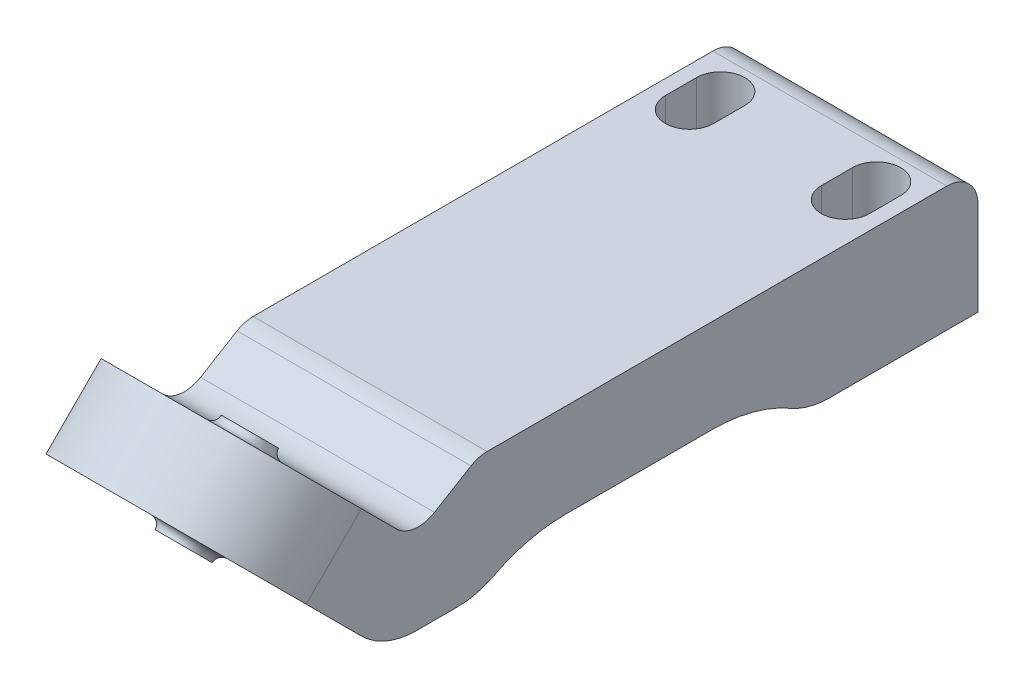
from build123d import *

# Parameters (mm, degrees)
SKETCH_10_W         = 15
SKETCH_10_H         = 8
EXTRUDE_7_DEPTH     = 26
CUT_EXTRUDE_4_DEPTH = 11
SKETCH_12_W         = 15
SKETCH_12_H         = 6
EXTRUDE_8_DEPTH     = 6
SKETCH_14_W         = 15
SKETCH_14_H         = 5
EXTRUDE_9_DEPTH     = 4
EXTRUDE_10_DEPTH    = 15
EXTRUDE_11_DEPTH    = 5
SKETCH_19_R         = 1.1
CUT_EXTRUDE_5_DEPTH = 5
EXTRUDE_START       = 0.5
SKETCH_20_R         = 1.5
SKETCH_20_R_2       = 1.1
EXTRUDE_12_DEPTH    = 0.5
SKETCH_21_R         = 1.5
SKETCH_21_R_2       = 1.1
EXTRUDE_13_DEPTH    = 0.5
FILLET_4_R          = 0.5
CHAMFER_1_SIZE      = 4.493554602
CHAMFER_1_SIZE_2    = 2.7
FILLET_7_R          = 2
SKETCH_22_W         = 15
SKETCH_22_H         = 2
CUT_EXTRUDE_6_DEPTH = 15
FILLET_8_R          = 10
FILLET_9_R          = 5
FILLET_10_R         = 2


# Some blends are built 0.0001 mm under size
with BuildPart() as part:
    # 草图10 → 凸台-拉伸7 (new body)
    with BuildSketch(Plane.XY):
        with Locations((0, 24.68211788)):
            Rectangle(SKETCH_10_W, SKETCH_10_H)
    extrude(amount=EXTRUDE_7_DEPTH)

    # 草图11 → 切除-拉伸4 (cut)
    with BuildSketch(Plane(origin=(0, 28.68211788, 0), x_dir=(1, 0, 0), z_dir=(0, 1, 0))):
        with BuildLine():
            Line((-3.45, -4), (-3.45, -6))
            ThreePointArc((-3.45, -6), (-5, -7.55), (-6.55, -6))
            Line((-6.55, -6), (-6.55, -4))
            ThreePointArc((-6.55, -4), (-5, -2.45), (-3.45, -4))
        make_face()
        with BuildLine():
            Line((3.45, -4), (3.45, -6))
            ThreePointArc((3.45, -6), (5, -7.55), (6.55, -6))
            Line((6.55, -6), (6.55, -4))
            ThreePointArc((6.55, -4), (5, -2.45), (3.45, -4))
        make_face()
    extrude(amount=-CUT_EXTRUDE_4_DEPTH, mode=Mode.SUBTRACT)

    # 草图12 → 凸台-拉伸8 (add)
    with BuildSketch(Plane.XY.offset(26)):
        with Locations((0, 25.68211788)):
            Rectangle(SKETCH_12_W, SKETCH_12_H)
    extrude(amount=EXTRUDE_8_DEPTH)

    # 草图14 → 凸台-拉伸9 (add)
    with BuildSketch(Plane.XY.offset(32)):
        with Locations((0, 23.5)):
            Rectangle(SKETCH_14_W, SKETCH_14_H)
    extrude(amount=EXTRUDE_9_DEPTH)

    # 草图17 → 凸台-拉伸10 (add)
    with BuildSketch(Plane.ZY.offset(7.5)):
        Polygon((36, 26), (39.535533906, 29.535533906), (43.071067812, 26), (38.071067812, 21), (36, 21), align=None)
    extrude(amount=-EXTRUDE_10_DEPTH)

    # 草图18 → 凸台-拉伸11 (add)
    with BuildSketch(Plane(origin=(0, -8.535533906, 8.535533906), x_dir=(1, 0, 0), z_dir=(0, -0.7071067811865507, 0.7071067811865445))):
        with BuildLine():
            Line((7.5, 48.840620434), (-7.5, 48.840620434))
            ThreePointArc((-7.5, 48.840620434), (0, 56.340620434), (7.5, 48.840620434))
        make_face()
    extrude(amount=-EXTRUDE_11_DEPTH)

    # 草图19 → 切除-拉伸5 (cut)
    with BuildSketch(Plane(origin=(0, -8.535533906, 8.535533906), x_dir=(1, 0, 0), z_dir=(0, -0.7071067811865507, 0.7071067811865445))):
        with Locations(Location((0, 48.840620434, 0), (0, 0, 270))):
            Circle(SKETCH_19_R)
    extrude(amount=-CUT_EXTRUDE_5_DEPTH, mode=Mode.SUBTRACT)

    # 草图20 → 凸台-拉伸12 (add)
    with BuildSketch(Plane(origin=(0, -8.535533906, 8.535533906), x_dir=(1, 0, 0), z_dir=(0, -0.7071067811865507, 0.7071067811865445)).offset(EXTRUDE_START)):
        with Locations(Location((0, 48.840620434, 0), (0, 0, 270))):
            Circle(SKETCH_20_R)
        with Locations(Location((0, 48.840620434, 0), (0, 0, 270))):
            Circle(SKETCH_20_R_2, mode=Mode.SUBTRACT)
    extrude(amount=-EXTRUDE_12_DEPTH)

    # 草图21 → 凸台-拉伸13 (add)
    with BuildSketch(Plane(origin=(0, -5, 5), x_dir=(1, 0, 0), z_dir=(0, 0.7071067811865513, -0.7071067811865437))):
        with Locations(Location((0, -48.840620434, 0), (0, 0, 90))):
            Circle(SKETCH_21_R)
        with Locations(Location((0, -48.840620434, 0), (0, 0, 90))):
            Circle(SKETCH_21_R_2, mode=Mode.SUBTRACT)
    extrude(amount=EXTRUDE_13_DEPTH)

    # 圆角4
    fillet_4_edges = [part.edges().sort_by_distance(p)[0] for p in [
        (0, 27.060660172, 44.131727984),
        (0, 30.596194078, 40.596194078),
    ]]
    fillet(fillet_4_edges, radius=FILLET_4_R - 0.0001)  # a hair under: the kernel refuses the full size

    # 倒角1
    # the kernel refuses this chamfer: 4.493554602, 2.7 mm, written as the material it adds along each edge
    with BuildSketch(Plane(origin=(-7.5, 26, 32), x_dir=(0, -0.019914630580833353, 0.9998016840798123), z_dir=(1, 0, 0))) as chamfer_1_piece_1_section:
        Polygon((CHAMFER_1_SIZE * 0.999801684157, -CHAMFER_1_SIZE * 0.0199146305824), (-CHAMFER_1_SIZE_2 * 0.0199146305808, -CHAMFER_1_SIZE_2 * 0.99980168408), (0, 0), align=None)
    chamfer_1_piece_1 = extrude(amount=15, mode=Mode.PRIVATE)
    chamfer_1_piece_1 = split(chamfer_1_piece_1, bisect_by=Plane(origin=(0, 28.68211788, 33.477199106), z_dir=(0, -1, 0)), keep=Keep.TOP, mode=Mode.PRIVATE)
    add(chamfer_1_piece_1)

    # 圆角7
    fillet_7_edges = [part.edges().sort_by_distance(p)[0] for p in [
        (0, 26.18524881, 36.18524881),
        (0, 28.68211788, 32.029760846),
    ]]
    fillet(fillet_7_edges, radius=FILLET_7_R)

    # 草图22 → 切除-拉伸6 (cut)
    with BuildSketch(Plane.XY.offset(26)):
        with Locations((0, 21.68211788)):
            Rectangle(SKETCH_22_W, SKETCH_22_H)
    extrude(amount=-CUT_EXTRUDE_6_DEPTH, mode=Mode.SUBTRACT)

    # 圆角8
    # the kernel refuses this fillet: 10 mm, written as the material it adds along each edge
    with BuildSketch(Plane(origin=(7.5, 22.68211788, 11), x_dir=(0, -1, 0), z_dir=(-1, 0, 0))) as fillet_8_piece_1:
        with BuildLine():
            CenterArc((10, 6), FILLET_8_R, 180, 36.869897646)
            Line((0, 6), (-0.2, 6))
            Line((-0.2, 6), (-0.2, 0))
            Line((-0.2, 0), (0, -0.2))
            ThreePointArc((0, -0.2), (1, -0.2), (1.84, -0.12))
            Line((1.84, -0.12), (2, 0))
        make_face()
    extrude(amount=15)
    with BuildSketch(Plane(origin=(7.5, 22.68211788, 32), x_dir=(0, 0, -1), z_dir=(-1, 0, 0))) as fillet_8_piece_2:
        with BuildLine():
            CenterArc((5.550931186, 10), FILLET_8_R, 236.282871199, 33.717128801)
            Line((0, 1.68211788), (-0.111018624, 1.515760238))
            ThreePointArc((-0.111018624, 1.515760238), (-0.2, 0.84105894), (-0.2, 0))
            Line((-0.2, 0), (0, -0.2))
            Line((0, -0.2), (5.550931186, -0.2))
            Line((5.550931186, -0.2), (5.550931186, 0))
        make_face()
    extrude(amount=15)

    # 圆角9
    fillet_9_edges = [part.edges().sort_by_distance(p)[0] for p in [
        (0, 20.68211788, 11),
        (0, 21, 32),
        (0, 21, 38.071067812),
    ]]
    fillet(fillet_9_edges, radius=FILLET_9_R)

    # 圆角10
    fillet_10_edges = [part.edges().sort_by_distance(p)[0] for p in [
        (0, 28.68211788, 0),
    ]]
    fillet(fillet_10_edges, radius=FILLET_10_R)


solid = part.part
